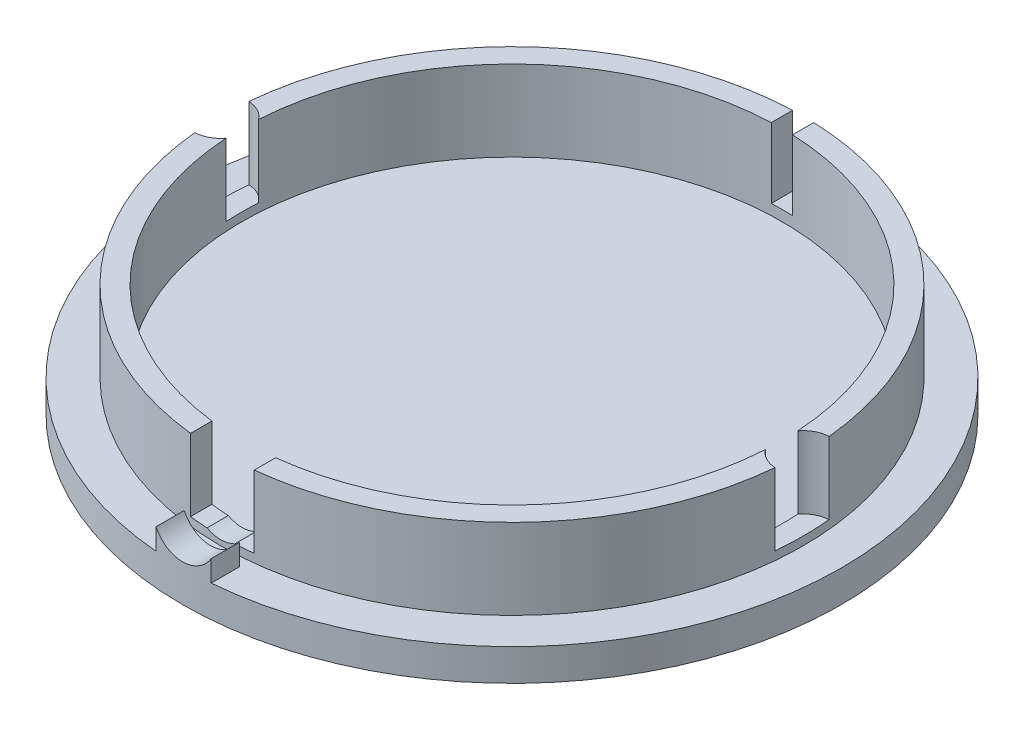
from build123d import *

# Parameters (mm, degrees)
SKETCH1_R           = 31.06
BOSS_EXTRUDE1_DEPTH = 3
SKETCH2_R           = 27.46
SKETCH2_R_2         = 25.46
BOSS_EXTRUDE2_DEPTH = 7.6
CUT_EXTRUDE1_START  = -6.8
CUT_EXTRUDE1_DEPTH  = 6.8
CUT_EXTRUDE2_START  = -6.8
CUT_EXTRUDE2_DEPTH  = 6.8
BOSS_EXTRUDE5_DEPTH = 7.6
CUT_EXTRUDE3_DEPTH  = 7.6
SKETCH9_W           = 2
SKETCH9_H           = 6.6
CUT_EXTRUDE4_DEPTH  = 46.186360866
BOSS_EXTRUDE6_DEPTH = 3.5


with BuildPart() as part:
    # Sketch1 → Boss-Extrude1 (new body)
    with BuildSketch(Plane(origin=(0, 0, 0), x_dir=(1, 0, 0), z_dir=(0, 1, 0))):
        Circle(SKETCH1_R)
    extrude(amount=BOSS_EXTRUDE1_DEPTH)

    # Sketch2 → Boss-Extrude2 (add)
    with BuildSketch(Plane(origin=(0, 3, 0), x_dir=(1, 0, 0), z_dir=(0, 1, 0))):
        Circle(SKETCH2_R)
        Circle(SKETCH2_R_2, mode=Mode.SUBTRACT)
    extrude(amount=BOSS_EXTRUDE2_DEPTH)

    # Sketch4 → Cut-Extrude1 (cut)
    with BuildSketch(Plane(origin=(0, 10.6, 0), x_dir=(1, 0, 0), z_dir=(0, 1, 0)).offset(CUT_EXTRUDE1_START)):
        with BuildLine():
            ThreePointArc((25.414433722, 1.522550032), (25.46, 0), (25.414433722, -1.522550032))
            ThreePointArc((25.414433722, -1.522550032), (26.262841127, -2.251512965), (27.34160051, -2.547249803))
            ThreePointArc((27.34160051, -2.547249803), (27.46, 0), (27.34160051, 2.547249803))
            ThreePointArc((27.34160051, 2.547249803), (26.262841127, 2.251512965), (25.414433722, 1.522550032))
        make_face()
        with BuildLine():
            ThreePointArc((-27.34160051, -2.547249803), (-26.262841127, -2.251512965), (-25.414433722, -1.522550032))
            ThreePointArc((-25.414433722, -1.522550032), (-25.46, 0), (-25.414433722, 1.522550032))
            ThreePointArc((-25.414433722, 1.522550032), (-26.262841127, 2.251512965), (-27.34160051, 2.547249803))
            ThreePointArc((-27.34160051, 2.547249803), (-27.46, 0), (-27.34160051, -2.547249803))
        make_face()
    extrude(amount=CUT_EXTRUDE1_DEPTH, mode=Mode.SUBTRACT)

    # Sketch5 → Cut-Extrude2 (cut)
    with BuildSketch(Plane(origin=(0, 10.6, 0), x_dir=(1, 0, 0), z_dir=(0, 1, 0)).offset(CUT_EXTRUDE2_START)):
        with BuildLine():
            ThreePointArc((3, -25.282634356), (0, -25.46), (-3, -25.282634356))
            Line((-3, -25.282634356), (-3, -27.29563335))
            ThreePointArc((-3, -27.29563335), (0, -27.46), (3, -27.29563335))
            Line((3, -27.29563335), (3, -25.282634356))
        make_face()
    extrude(amount=CUT_EXTRUDE2_DEPTH, mode=Mode.SUBTRACT)

    # Sketch7 → Boss-Extrude5 (add)
    with BuildSketch(Plane(origin=(0, 3, 0), x_dir=(1, 0, 0), z_dir=(0, 1, 0))):
        with BuildLine():
            Line((2.6, -28.301441659), (2.6, -30.95098706))
            ThreePointArc((2.6, -30.95098706), (0, -31.06), (-2.6, -30.95098706))
            Line((-2.6, -30.95098706), (-2.6, -28.301441659))
            ThreePointArc((-2.6, -28.301441659), (0, -28.420453674), (2.6, -28.301441659))
        make_face()
    extrude(amount=BOSS_EXTRUDE5_DEPTH)

    # Sketch8 → Cut-Extrude3 (cut)
    with BuildSketch(Plane.XY.offset(31.06)):
        with BuildLine():
            Line((2.6, 10.6), (-2.6, 10.6))
            Line((-2.6, 10.6), (-2.6, 5.003337045))
            ThreePointArc((-2.6, 5.003337045), (0, 3.5), (2.6, 5.003337045))
            Line((2.6, 5.003337045), (2.6, 10.6))
        make_face()
    extrude(amount=-CUT_EXTRUDE3_DEPTH, mode=Mode.SUBTRACT)

    # Sketch9 → Cut-Extrude4 (cut, through all)
    with BuildSketch(Plane.XY):
        with Locations((0, 7.3)):
            Rectangle(SKETCH9_W, SKETCH9_H)
    extrude(amount=-CUT_EXTRUDE4_DEPTH, mode=Mode.SUBTRACT)

    # Sketch10 → Boss-Extrude6 (add)
    with BuildSketch(Plane(origin=(0, 3, 0), x_dir=(1, 0, 0), z_dir=(0, 1, 0))):
        with BuildLine():
            Line((-0.7, 31.052111039), (-0.7, 28.442426057))
            ThreePointArc((-0.7, 28.442426057), (0, 28.451035933), (0.7, 28.442426057))
            Line((0.7, 28.442426057), (0.7, 31.052111039))
            ThreePointArc((0.7, 31.052111039), (0, 31.06), (-0.7, 31.052111039))
        make_face()
    extrude(amount=BOSS_EXTRUDE6_DEPTH)


solid = part.part
